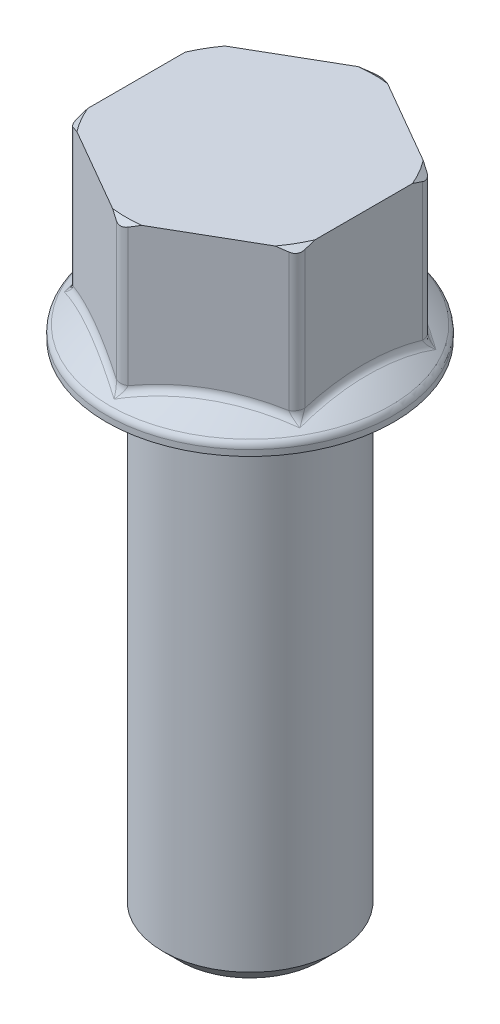
from build123d import *

# Parameters (mm, degrees)
SKETCH1_R           = 4.3
EXTRUDE1_DEPTH      = 0.3
DOME1_FACE_RADIUS   = 4.3
DOME1_HEIGHT        = 1.5
EXTRUDE2_REACH      = 9.873
EXTRUDE2_END_RADIUS = 6.913333333
SKETCH10_OUTSIDE_W  = 20.91
SKETCH10_OUTSIDE_H  = 20.91
SKETCH10_OUTSIDE_R  = 3.7
EXTRUDE4_DEPTH      = 3
EXTRUDE4_DRAFT      = -52
SKETCH11_R          = 3.5
EXTRUDE5_DEPTH      = 0.06
SKETCH12_R          = 2.6
EXTRUDE6_DEPTH      = 15
CHAMFER1_SIZE       = 0.5
FILLET1_R           = 0.25
FILLET2_R           = 0.35


with BuildPart() as part:
    # Sketch1 → Extrude1 (new body)
    with BuildSketch(Plane(origin=(0, 0, 0), x_dir=(1, 0, 0), z_dir=(0, 1, 0))):
        with Locations(Location((0, 0, 0), (0, 0, 270))):
            Circle(SKETCH1_R)
    extrude(amount=EXTRUDE1_DEPTH)

    # Dome1: a dome of height H over a round flat face of radius A is a cap of a sphere of radius (A * A + H * H) / (2 * H)
    dome1_r = (DOME1_FACE_RADIUS * DOME1_FACE_RADIUS + DOME1_HEIGHT * DOME1_HEIGHT) / (2 * DOME1_HEIGHT)
    dome1_base = Plane((0, 0.3, 0), z_dir=(0, 1, 0))
    with Locations(dome1_base.offset(DOME1_HEIGHT - dome1_r)):
        dome1_ball = Sphere(dome1_r, mode=Mode.PRIVATE)
    add(split(dome1_ball, bisect_by=dome1_base, keep=Keep.TOP, mode=Mode.PRIVATE))

    # Extrude2: up to this sphere (the profile starts outside it)
    extrude2_end = Location((0, -5.113333333, 0)) * Sphere(EXTRUDE2_END_RADIUS, mode=Mode.PRIVATE)
    # Sketch2 → Extrude2 (add, up to the surface)
    with BuildSketch(Plane.XZ.offset(-5), mode=Mode.PRIVATE) as extrude2_sk1:
        Polygon((0, 3.92598183), (-3.4, 1.962990915), (-3.4, -1.962990915), (0, -3.92598183), (3.4, -1.962990915), (3.4, 1.962990915), align=None)
    extrude2_tool1 = extrude(extrude2_sk1.sketch, amount=EXTRUDE2_REACH, mode=Mode.PRIVATE) - extrude2_end
    add(extrude2_tool1.solids().sort_by_distance((0, 5, 0))[0])


with BuildPart() as extrude4_tool:
    # Sketch10 outside → Extrude4 (with draft: the straight prism first)
    with BuildSketch(Plane(origin=(0, 5, 0), x_dir=(1, 0, 0), z_dir=(0, 1, 0))):
        Rectangle(SKETCH10_OUTSIDE_W, SKETCH10_OUTSIDE_H)
        Circle(SKETCH10_OUTSIDE_R, mode=Mode.SUBTRACT)
    extrude(amount=-EXTRUDE4_DEPTH)
    # Extrude4: the draft: its side faces are tilted about the plane it starts from
    extrude4_sides = [extrude4_tool.faces().sort_by_distance(p)[0] for p in [
        (0, 3.5, 10.455),
        (10.455, 3.5, 0),
        (0, 3.5, -10.455),
        (-10.455, 3.5, 0),
        (-3.7, 3.5, 0),
    ]]
    draft(extrude4_sides, Plane(origin=(0, 5, 0), x_dir=(1, 0, 0), z_dir=(0, 1, 0)), EXTRUDE4_DRAFT)


with BuildPart() as part_1:
    add(part.part)

    # Extrude4: cut by extrude4_tool
    add(extrude4_tool.part, mode=Mode.SUBTRACT)

    # Sketch11 → Extrude5 (add)
    with BuildSketch(Plane.XZ):
        with Locations(Location((0, 0, 0), (0, 0, 90))):
            Circle(SKETCH11_R)
    extrude(amount=EXTRUDE5_DEPTH)

    # Sketch12 → Extrude6 (add)
    with BuildSketch(Plane.XZ.offset(0.06)):
        with Locations(Location((0, 0, 0), (0, 0, 270))):
            Circle(SKETCH12_R)
    extrude(amount=EXTRUDE6_DEPTH)

    # Chamfer1
    chamfer1_edges = [part_1.edges().sort_by_distance(p)[0] for p in [
        (0, -15.06, 2.6),
    ]]
    chamfer(chamfer1_edges, length=CHAMFER1_SIZE)

    # Fillet1
    # the kernel refuses this fillet: 0.25 mm, written as the material it adds along each edge
    with BuildSketch(Plane(origin=(-3.4, -5.113333333, 0), x_dir=(0, 0.9241201145219472, -0.38210209883739604), z_dir=(0, -0.38210209883739604, -0.9241201145219472))) as fillet1_piece_1_section:
        with BuildLine():
            CenterArc((6.163671345, -0.25), FILLET1_R, 90, 59.366851008)
            Line((6.163671345, 0), (6.019483182, 0))
            ThreePointArc((6.019483182, 0), (5.984335388, -0.061489237), (5.948559502, -0.12261517))
        make_face()
    fillet1_piece_1 = revolve(axis=Axis((-3.4, -5.113333333, 0), (1, 0, 0)), revolution_arc=44.927904842, mode=Mode.PRIVATE)
    fillet1_piece_1 = split(fillet1_piece_1, bisect_by=Plane(origin=(-4.25, -5.113333333, -1.472243186), z_dir=(0.49999999999999983, 0, 0.8660254037844388)), keep=Keep.TOP, mode=Mode.PRIVATE)
    fillet1_piece_1 = split(fillet1_piece_1, bisect_by=Plane(origin=(-4.25, -5.113333333, 1.472243186), z_dir=(0.5000000000000001, 0, -0.8660254037844386)), keep=Keep.TOP, mode=Mode.PRIVATE)
    add(fillet1_piece_1)
    with BuildSketch(Plane(origin=(-1.7, -5.113333333, -2.944486373), x_dir=(0.3309101244325375, 0.9241201145219472, -0.191051049418698), z_dir=(0.8003114953241912, -0.3821020988373961, -0.46206005726097343))) as fillet1_piece_2_section:
        with BuildLine():
            CenterArc((6.163671345, -0.25), FILLET1_R, 90, 59.366851008)
            Line((6.163671345, 0), (6.019483182, 0))
            ThreePointArc((6.019483182, 0), (5.984335388, -0.061489237), (5.948559502, -0.12261517))
        make_face()
    fillet1_piece_2 = revolve(axis=Axis((-1.7, -5.113333333, -2.944486373), (0.49999999999999983, 0, 0.8660254037844388)), revolution_arc=44.927904842, mode=Mode.PRIVATE)
    fillet1_piece_2 = split(fillet1_piece_2, bisect_by=Plane(origin=(-0.85, -5.113333333, -4.416729559), z_dir=(-0.49999999999999994, 0, 0.8660254037844387)), keep=Keep.TOP, mode=Mode.PRIVATE)
    fillet1_piece_2 = split(fillet1_piece_2, bisect_by=Plane(origin=(-3.4, -5.113333333, -2.944486373), z_dir=(1, 0, 0)), keep=Keep.TOP, mode=Mode.PRIVATE)
    add(fillet1_piece_2)
    with BuildSketch(Plane(origin=(1.7, -5.113333333, -2.944486373), x_dir=(0.3309101244325374, 0.9241201145219472, 0.191051049418698), z_dir=(0.8003114953241911, -0.3821020988373961, 0.46206005726097354))) as fillet1_piece_3_section:
        with BuildLine():
            CenterArc((6.163671345, -0.25), FILLET1_R, 90, 59.366851008)
            Line((6.163671345, 0), (6.019483182, 0))
            ThreePointArc((6.019483182, 0), (5.984335388, -0.061489237), (5.948559502, -0.12261517))
        make_face()
    fillet1_piece_3 = revolve(axis=Axis((1.7, -5.113333333, -2.944486373), (-0.49999999999999994, 0, 0.8660254037844387)), revolution_arc=44.927904842, mode=Mode.PRIVATE)
    fillet1_piece_3 = split(fillet1_piece_3, bisect_by=Plane(origin=(3.4, -5.113333333, -2.944486373), z_dir=(-1, 0, 0)), keep=Keep.TOP, mode=Mode.PRIVATE)
    fillet1_piece_3 = split(fillet1_piece_3, bisect_by=Plane(origin=(0.85, -5.113333333, -4.416729559), z_dir=(0.49999999999999983, 0, 0.8660254037844388)), keep=Keep.TOP, mode=Mode.PRIVATE)
    add(fillet1_piece_3)
    with BuildSketch(Plane(origin=(3.4, -5.113333333, 0), x_dir=(0, 0.9241201145219469, 0.3821020988373969), z_dir=(0, -0.3821020988373969, 0.9241201145219469))) as fillet1_piece_4_section:
        with BuildLine():
            CenterArc((6.163671345, -0.25), FILLET1_R, 90, 59.366851008)
            Line((6.163671345, 0), (6.019483182, 0))
            ThreePointArc((6.019483182, 0), (5.984335388, -0.061489237), (5.948559502, -0.12261517))
        make_face()
    fillet1_piece_4 = revolve(axis=Axis((3.4, -5.113333333, 0), (-1, 0, 0)), revolution_arc=44.927904842, mode=Mode.PRIVATE)
    fillet1_piece_4 = split(fillet1_piece_4, bisect_by=Plane(origin=(4.25, -5.113333333, 1.472243186), z_dir=(-0.49999999999999967, 0, -0.8660254037844388)), keep=Keep.TOP, mode=Mode.PRIVATE)
    fillet1_piece_4 = split(fillet1_piece_4, bisect_by=Plane(origin=(4.25, -5.113333333, -1.472243186), z_dir=(-0.49999999999999994, 0, 0.8660254037844387)), keep=Keep.TOP, mode=Mode.PRIVATE)
    add(fillet1_piece_4)
    with BuildSketch(Plane(origin=(1.7, -5.113333333, 2.944486373), x_dir=(-0.3309101244325375, 0.9241201145219473, 0.191051049418698), z_dir=(-0.8003114953241912, -0.3821020988373961, 0.4620600572609733))) as fillet1_piece_5_section:
        with BuildLine():
            CenterArc((6.163671345, -0.25), FILLET1_R, 90, 59.366851008)
            Line((6.163671345, 0), (6.019483182, 0))
            ThreePointArc((6.019483182, 0), (5.984335388, -0.061489237), (5.948559502, -0.12261517))
        make_face()
    fillet1_piece_5 = revolve(axis=Axis((1.7, -5.113333333, 2.944486373), (-0.49999999999999967, 0, -0.8660254037844388)), revolution_arc=44.927904842, mode=Mode.PRIVATE)
    fillet1_piece_5 = split(fillet1_piece_5, bisect_by=Plane(origin=(3.4, -5.113333333, 2.944486373), z_dir=(-1, 0, 0)), keep=Keep.TOP, mode=Mode.PRIVATE)
    fillet1_piece_5 = split(fillet1_piece_5, bisect_by=Plane(origin=(0.85, -5.113333333, 4.416729559), z_dir=(0.5000000000000001, 0, -0.8660254037844386)), keep=Keep.TOP, mode=Mode.PRIVATE)
    add(fillet1_piece_5)
    with BuildSketch(Plane(origin=(-1.7, -5.113333333, 2.944486373), x_dir=(-0.3309101244325373, 0.9241201145219472, -0.19105104941869805), z_dir=(-0.800311495324191, -0.382102098837396, -0.4620600572609737))) as fillet1_piece_6_section:
        with BuildLine():
            CenterArc((6.163671345, -0.25), FILLET1_R, 90, 59.366851008)
            Line((6.163671345, 0), (6.019483182, 0))
            ThreePointArc((6.019483182, 0), (5.984335388, -0.061489237), (5.948559502, -0.12261517))
        make_face()
    fillet1_piece_6 = revolve(axis=Axis((-1.7, -5.113333333, 2.944486373), (0.5000000000000001, 0, -0.8660254037844386)), revolution_arc=44.927904842, mode=Mode.PRIVATE)
    fillet1_piece_6 = split(fillet1_piece_6, bisect_by=Plane(origin=(-0.85, -5.113333333, 4.416729559), z_dir=(-0.49999999999999967, 0, -0.8660254037844388)), keep=Keep.TOP, mode=Mode.PRIVATE)
    fillet1_piece_6 = split(fillet1_piece_6, bisect_by=Plane(origin=(-3.4, -5.113333333, 2.944486373), z_dir=(1, 0, 0)), keep=Keep.TOP, mode=Mode.PRIVATE)
    add(fillet1_piece_6)
    with BuildSketch(Plane(origin=(-1.7, -5.113333333, -2.944486373), x_dir=(0.3309101244325375, 0.9241201145219472, -0.191051049418698), z_dir=(0.8003114953241912, -0.3821020988373961, -0.46206005726097343))) as fillet1_piece_7a_section:
        with BuildLine():
            CenterArc((6.163671345, -0.25), FILLET1_R, 90, 59.366851008)
            Line((6.163671345, 0), (6.019483182, 0))
            ThreePointArc((6.019483182, 0), (5.984335388, -0.061489237), (5.948559502, -0.12261517))
        make_face()
    fillet1_piece_7a = revolve(axis=Axis((-1.7, -5.113333333, -2.944486373), (0.49999999999999983, 0, 0.8660254037844388)), revolution_arc=44.927904842, mode=Mode.PRIVATE)
    fillet1_piece_7a = split(fillet1_piece_7a, bisect_by=Plane(origin=(-3.4, -5.113333333, -2.944486373), z_dir=(-1, 0, 0)), keep=Keep.TOP, mode=Mode.PRIVATE)
    with BuildSketch(Plane(origin=(-3.4, -5.113333333, 0), x_dir=(0, 0.9241201145219472, -0.38210209883739604), z_dir=(0, -0.38210209883739604, -0.9241201145219472))) as fillet1_piece_7b_section:
        with BuildLine():
            CenterArc((6.163671345, -0.25), FILLET1_R, 90, 59.366851008)
            Line((6.163671345, 0), (6.019483182, 0))
            ThreePointArc((6.019483182, 0), (5.984335388, -0.061489237), (5.948559502, -0.12261517))
        make_face()
    fillet1_piece_7b = revolve(axis=Axis((-3.4, -5.113333333, 0), (1, 0, 0)), revolution_arc=44.927904842, mode=Mode.PRIVATE)
    fillet1_piece_7b = split(fillet1_piece_7b, bisect_by=Plane(origin=(-4.25, -5.113333333, -1.472243186), z_dir=(-0.49999999999999983, 0, -0.8660254037844388)), keep=Keep.TOP, mode=Mode.PRIVATE)
    fillet1_piece_7 = fillet1_piece_7a & fillet1_piece_7b
    add(fillet1_piece_7)
    with BuildSketch(Plane(origin=(-3.4, -5.113333333, 0), x_dir=(0, 0.9241201145219472, -0.38210209883739604), z_dir=(0, -0.38210209883739604, -0.9241201145219472))) as fillet1_piece_8a_section:
        with BuildLine():
            CenterArc((6.163671345, -0.25), FILLET1_R, 90, 59.366851008)
            Line((6.163671345, 0), (6.019483182, 0))
            ThreePointArc((6.019483182, 0), (5.984335388, -0.061489237), (5.948559502, -0.12261517))
        make_face()
    fillet1_piece_8a = revolve(axis=Axis((-3.4, -5.113333333, 0), (1, 0, 0)), revolution_arc=44.927904842, mode=Mode.PRIVATE)
    fillet1_piece_8a = split(fillet1_piece_8a, bisect_by=Plane(origin=(-4.25, -5.113333333, 1.472243186), z_dir=(-0.5000000000000001, 0, 0.8660254037844386)), keep=Keep.TOP, mode=Mode.PRIVATE)
    with BuildSketch(Plane(origin=(-1.7, -5.113333333, 2.944486373), x_dir=(-0.3309101244325373, 0.9241201145219472, -0.19105104941869805), z_dir=(-0.800311495324191, -0.382102098837396, -0.4620600572609737))) as fillet1_piece_8b_section:
        with BuildLine():
            CenterArc((6.163671345, -0.25), FILLET1_R, 90, 59.366851008)
            Line((6.163671345, 0), (6.019483182, 0))
            ThreePointArc((6.019483182, 0), (5.984335388, -0.061489237), (5.948559502, -0.12261517))
        make_face()
    fillet1_piece_8b = revolve(axis=Axis((-1.7, -5.113333333, 2.944486373), (0.5000000000000001, 0, -0.8660254037844386)), revolution_arc=44.927904842, mode=Mode.PRIVATE)
    fillet1_piece_8b = split(fillet1_piece_8b, bisect_by=Plane(origin=(-3.4, -5.113333333, 2.944486373), z_dir=(-1, 0, 0)), keep=Keep.TOP, mode=Mode.PRIVATE)
    fillet1_piece_8 = fillet1_piece_8a & fillet1_piece_8b
    add(fillet1_piece_8)
    with BuildSketch(Plane(origin=(1.7, -5.113333333, -2.944486373), x_dir=(0.3309101244325374, 0.9241201145219472, 0.191051049418698), z_dir=(0.8003114953241911, -0.3821020988373961, 0.46206005726097354))) as fillet1_piece_9a_section:
        with BuildLine():
            CenterArc((6.163671345, -0.25), FILLET1_R, 90, 59.366851008)
            Line((6.163671345, 0), (6.019483182, 0))
            ThreePointArc((6.019483182, 0), (5.984335388, -0.061489237), (5.948559502, -0.12261517))
        make_face()
    fillet1_piece_9a = revolve(axis=Axis((1.7, -5.113333333, -2.944486373), (-0.49999999999999994, 0, 0.8660254037844387)), revolution_arc=44.927904842, mode=Mode.PRIVATE)
    fillet1_piece_9a = split(fillet1_piece_9a, bisect_by=Plane(origin=(0.85, -5.113333333, -4.416729559), z_dir=(-0.49999999999999983, 0, -0.8660254037844388)), keep=Keep.TOP, mode=Mode.PRIVATE)
    with BuildSketch(Plane(origin=(-1.7, -5.113333333, -2.944486373), x_dir=(0.3309101244325375, 0.9241201145219472, -0.191051049418698), z_dir=(0.8003114953241912, -0.3821020988373961, -0.46206005726097343))) as fillet1_piece_9b_section:
        with BuildLine():
            CenterArc((6.163671345, -0.25), FILLET1_R, 90, 59.366851008)
            Line((6.163671345, 0), (6.019483182, 0))
            ThreePointArc((6.019483182, 0), (5.984335388, -0.061489237), (5.948559502, -0.12261517))
        make_face()
    fillet1_piece_9b = revolve(axis=Axis((-1.7, -5.113333333, -2.944486373), (0.49999999999999983, 0, 0.8660254037844388)), revolution_arc=44.927904842, mode=Mode.PRIVATE)
    fillet1_piece_9b = split(fillet1_piece_9b, bisect_by=Plane(origin=(-0.85, -5.113333333, -4.416729559), z_dir=(0.49999999999999994, 0, -0.8660254037844387)), keep=Keep.TOP, mode=Mode.PRIVATE)
    fillet1_piece_9 = fillet1_piece_9a & fillet1_piece_9b
    add(fillet1_piece_9)
    with BuildSketch(Plane(origin=(3.4, -5.113333333, 0), x_dir=(0, 0.9241201145219469, 0.3821020988373969), z_dir=(0, -0.3821020988373969, 0.9241201145219469))) as fillet1_piece_10a_section:
        with BuildLine():
            CenterArc((6.163671345, -0.25), FILLET1_R, 90, 59.366851008)
            Line((6.163671345, 0), (6.019483182, 0))
            ThreePointArc((6.019483182, 0), (5.984335388, -0.061489237), (5.948559502, -0.12261517))
        make_face()
    fillet1_piece_10a = revolve(axis=Axis((3.4, -5.113333333, 0), (-1, 0, 0)), revolution_arc=44.927904842, mode=Mode.PRIVATE)
    fillet1_piece_10a = split(fillet1_piece_10a, bisect_by=Plane(origin=(4.25, -5.113333333, -1.472243186), z_dir=(0.49999999999999994, 0, -0.8660254037844387)), keep=Keep.TOP, mode=Mode.PRIVATE)
    with BuildSketch(Plane(origin=(1.7, -5.113333333, -2.944486373), x_dir=(0.3309101244325374, 0.9241201145219472, 0.191051049418698), z_dir=(0.8003114953241911, -0.3821020988373961, 0.46206005726097354))) as fillet1_piece_10b_section:
        with BuildLine():
            CenterArc((6.163671345, -0.25), FILLET1_R, 90, 59.366851008)
            Line((6.163671345, 0), (6.019483182, 0))
            ThreePointArc((6.019483182, 0), (5.984335388, -0.061489237), (5.948559502, -0.12261517))
        make_face()
    fillet1_piece_10b = revolve(axis=Axis((1.7, -5.113333333, -2.944486373), (-0.49999999999999994, 0, 0.8660254037844387)), revolution_arc=44.927904842, mode=Mode.PRIVATE)
    fillet1_piece_10b = split(fillet1_piece_10b, bisect_by=Plane(origin=(3.4, -5.113333333, -2.944486373), z_dir=(1, 0, 0)), keep=Keep.TOP, mode=Mode.PRIVATE)
    fillet1_piece_10 = fillet1_piece_10a & fillet1_piece_10b
    add(fillet1_piece_10)
    with BuildSketch(Plane(origin=(1.7, -5.113333333, 2.944486373), x_dir=(-0.3309101244325375, 0.9241201145219473, 0.191051049418698), z_dir=(-0.8003114953241912, -0.3821020988373961, 0.4620600572609733))) as fillet1_piece_11a_section:
        with BuildLine():
            CenterArc((6.163671345, -0.25), FILLET1_R, 90, 59.366851008)
            Line((6.163671345, 0), (6.019483182, 0))
            ThreePointArc((6.019483182, 0), (5.984335388, -0.061489237), (5.948559502, -0.12261517))
        make_face()
    fillet1_piece_11a = revolve(axis=Axis((1.7, -5.113333333, 2.944486373), (-0.49999999999999967, 0, -0.8660254037844388)), revolution_arc=44.927904842, mode=Mode.PRIVATE)
    fillet1_piece_11a = split(fillet1_piece_11a, bisect_by=Plane(origin=(3.4, -5.113333333, 2.944486373), z_dir=(1, 0, 0)), keep=Keep.TOP, mode=Mode.PRIVATE)
    with BuildSketch(Plane(origin=(3.4, -5.113333333, 0), x_dir=(0, 0.9241201145219469, 0.3821020988373969), z_dir=(0, -0.3821020988373969, 0.9241201145219469))) as fillet1_piece_11b_section:
        with BuildLine():
            CenterArc((6.163671345, -0.25), FILLET1_R, 90, 59.366851008)
            Line((6.163671345, 0), (6.019483182, 0))
            ThreePointArc((6.019483182, 0), (5.984335388, -0.061489237), (5.948559502, -0.12261517))
        make_face()
    fillet1_piece_11b = revolve(axis=Axis((3.4, -5.113333333, 0), (-1, 0, 0)), revolution_arc=44.927904842, mode=Mode.PRIVATE)
    fillet1_piece_11b = split(fillet1_piece_11b, bisect_by=Plane(origin=(4.25, -5.113333333, 1.472243186), z_dir=(0.49999999999999967, 0, 0.8660254037844388)), keep=Keep.TOP, mode=Mode.PRIVATE)
    fillet1_piece_11 = fillet1_piece_11a & fillet1_piece_11b
    add(fillet1_piece_11)
    with BuildSketch(Plane(origin=(1.7, -5.113333333, 2.944486373), x_dir=(-0.3309101244325375, 0.9241201145219473, 0.191051049418698), z_dir=(-0.8003114953241912, -0.3821020988373961, 0.4620600572609733))) as fillet1_piece_12a_section:
        with BuildLine():
            CenterArc((6.163671345, -0.25), FILLET1_R, 90, 59.366851008)
            Line((6.163671345, 0), (6.019483182, 0))
            ThreePointArc((6.019483182, 0), (5.984335388, -0.061489237), (5.948559502, -0.12261517))
        make_face()
    fillet1_piece_12a = revolve(axis=Axis((1.7, -5.113333333, 2.944486373), (-0.49999999999999967, 0, -0.8660254037844388)), revolution_arc=44.927904842, mode=Mode.PRIVATE)
    fillet1_piece_12a = split(fillet1_piece_12a, bisect_by=Plane(origin=(0.85, -5.113333333, 4.416729559), z_dir=(-0.5000000000000001, 0, 0.8660254037844386)), keep=Keep.TOP, mode=Mode.PRIVATE)
    with BuildSketch(Plane(origin=(-1.7, -5.113333333, 2.944486373), x_dir=(-0.3309101244325373, 0.9241201145219472, -0.19105104941869805), z_dir=(-0.800311495324191, -0.382102098837396, -0.4620600572609737))) as fillet1_piece_12b_section:
        with BuildLine():
            CenterArc((6.163671345, -0.25), FILLET1_R, 90, 59.366851008)
            Line((6.163671345, 0), (6.019483182, 0))
            ThreePointArc((6.019483182, 0), (5.984335388, -0.061489237), (5.948559502, -0.12261517))
        make_face()
    fillet1_piece_12b = revolve(axis=Axis((-1.7, -5.113333333, 2.944486373), (0.5000000000000001, 0, -0.8660254037844386)), revolution_arc=44.927904842, mode=Mode.PRIVATE)
    fillet1_piece_12b = split(fillet1_piece_12b, bisect_by=Plane(origin=(-0.85, -5.113333333, 4.416729559), z_dir=(0.49999999999999967, 0, 0.8660254037844388)), keep=Keep.TOP, mode=Mode.PRIVATE)
    fillet1_piece_12 = fillet1_piece_12a & fillet1_piece_12b
    add(fillet1_piece_12)
    # the kernel refuses this fillet: 0.25 mm, written as the material it takes off along each edge
    with BuildSketch(Plane(origin=(0, 0.3, 0), x_dir=(0, 0, 1), z_dir=(-1, 0, 0))) as fillet1_2_piece_1:
        with BuildLine():
            CenterArc((4.05, -0.122065894), FILLET1_R, 0, 52.569120389)
            ThreePointArc((4.201950975, 0.076455896), (4.251147371, 0.038448376), (4.3, 0))
            Line((4.3, 0), (4.3, -0.122065894))
        make_face()
    revolve(axis=Axis((0, 0.3, 0), (0, 1, 0)), mode=Mode.SUBTRACT)

    # Fillet2
    fillet2_edges = [part_1.edges().sort_by_distance(p)[0] for p in [
        (0, 0.586758802, 3.966926391),
        (-3.435459026, 0.586758791, 1.983463194),
        (-3.435459026, 0.586758791, -1.983463193),
        (0, 0.586758789, -3.966926388),
        (3.435459026, 0.586758791, -1.983463194),
        (3.435459026, 0.586758791, 1.983463193),
        (0, 2.776420894, 3.92598183),
        (-3.4, 2.776420894, 1.962990915),
        (-3.4, 2.776420894, -1.962990915),
        (0, 2.776420894, -3.92598183),
        (3.4, 2.776420894, -1.962990915),
        (3.4, 2.776420894, 1.962990915),
    ]]
    fillet(fillet2_edges, radius=FILLET2_R)


solid = part_1.part
